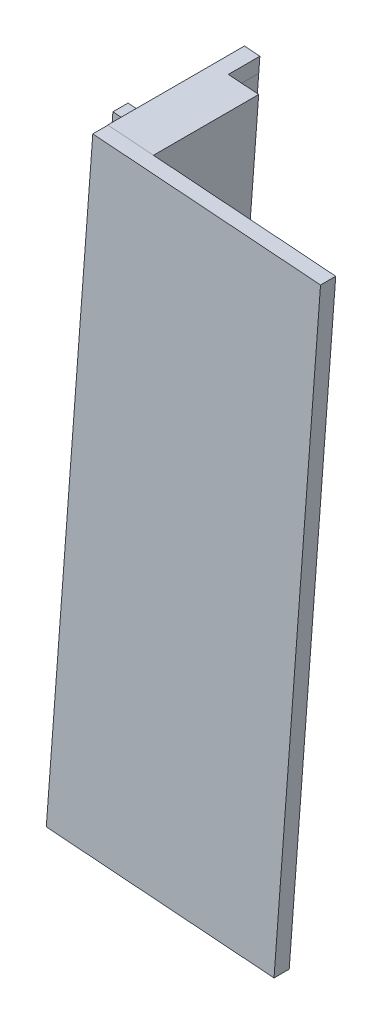
from build123d import *

# Parameters (mm, degrees)
BOSS_EXTRUDE2_DEPTH                           = 9
CUT_EXTRUDE3_DEPTH                            = 37.794697197
CUT_EXTRUDE3_DEPTH_BACK                       = 29.526
SKETCH3_W                                     = 54.22029704
SKETCH3_H                                     = 8
BOSS_EXTRUDE3_DEPTH                           = 14.032
BOSS_EXTRUDE3_DEPTH_BACK                      = 1
BOSS_EXTRUDE4_DEPTH                           = 2
CSK_FOR_3_FLAT_HEAD_SOCKET_CAP_SCREW1_A_COUNT = 2
CSK_FOR_3_FLAT_HEAD_SOCKET_CAP_SCREW1_A_PITCH = 19.290792


with BuildPart() as part:
    # Sketch2 → Boss-Extrude2 (new body)
    with BuildSketch(Plane.XY):
        Polygon((-9.096510891, -26.330282843), (-9.701316376, -34.435752293), (-2.609093023, -34.964952435), (-3.061940834, -41.033918716), (-2.048641284, -41.109525962), (-1.973042695, -40.096342438), (0.937582862, -1.088781958), (1.013181451, -0.075598434), (0, 0), (-0.567761002, -7.60900747), (-7.660098307, -7.079798826), (-8.264903605, -15.18526578), (-1.1725663, -15.714474425), (-2.004173586, -26.859491487), align=None)
    extrude(amount=BOSS_EXTRUDE2_DEPTH)

    # Sketch3 → Cut-Extrude3 (cut, two sides: drawn at the far end of the back side and taken through both)
    with BuildSketch(Plane(origin=(-2.608979071, -34.964960937, 0), x_dir=(0.9972277257028987, -0.07441010072177218, 0), z_dir=(-0.07441010072177218, -0.9972277257028987, 0)).offset(-CUT_EXTRUDE3_DEPTH_BACK)):
        with Locations((-27.110262789, 5)):
            Rectangle(SKETCH3_W, SKETCH3_H)
    extrude(amount=CUT_EXTRUDE3_DEPTH + CUT_EXTRUDE3_DEPTH_BACK, mode=Mode.SUBTRACT)

    # Sketch4 → Boss-Extrude3 (add, two sides: drawn at the far end of the back side and taken through both)
    with BuildSketch(Plane(origin=(1.013183369, -0.075600662, 0), x_dir=(0, 0, -1), z_dir=(0.9972277257028997, -0.07441010072175744, 0)).offset(-BOSS_EXTRUDE3_DEPTH_BACK)):
        Polygon((-9, -41.147998684), (-9, 2.079e-06), (-10, 0), (-10, -41.147998684), align=None)
    extrude(amount=BOSS_EXTRUDE3_DEPTH + BOSS_EXTRUDE3_DEPTH_BACK)


with BuildPart() as boss_extrude4_tool:
    # Sketch5 → Boss-Extrude4 (new body)
    with BuildSketch(Plane(origin=(1.013183369, -0.075600662, 0), x_dir=(0, 0, -1), z_dir=(0.9972277257028997, -0.07441010072175744, 0))):
        Polygon((-2.072367721, 0), (-9, 2.079e-06), (-9, -41.147998684), (-2.072367721, -41.147998684), align=None)
    extrude(amount=BOSS_EXTRUDE4_DEPTH)


with BuildPart() as part_1:
    add(part.part)


with BuildPart() as part_2:
    # Boss-Extrude4: joined with boss_extrude4_tool
    add(part_1.part.fuse(boss_extrude4_tool.part, tol=0.00001))

    # Sketch6 → CSK for #3 Flat Head Socket Cap Screw1 (revolve, cut)
    with BuildSketch(Plane(origin=(-4.41257913, -11.346475453, 1), x_dir=(0, -1, 0), z_dir=(1, 0, 0))):
        Polygon((0, 0), (0, 1), (1.397, 1), (1.397, 1.694722738), (2.8702, 0), align=None)
    csk_for_3_flat_head_socket_cap_screw1 = revolve(axis=Axis((-4.41257913, -11.346475453, 7.35), (0, 0, -1)), mode=Mode.SUBTRACT)

    # CSK for #3 Flat Head Socket Cap Screw1 a: CSK for #3 Flat Head Socket Cap Screw1 ×2
    with Locations(*[Vector(-0.07441010072177331, -0.9972277257028986, 0) * (i * CSK_FOR_3_FLAT_HEAD_SOCKET_CAP_SCREW1_A_PITCH) for i in range(1, CSK_FOR_3_FLAT_HEAD_SOCKET_CAP_SCREW1_A_COUNT)]):
        add(csk_for_3_flat_head_socket_cap_screw1, mode=Mode.SUBTRACT)


solid = part_2.part
